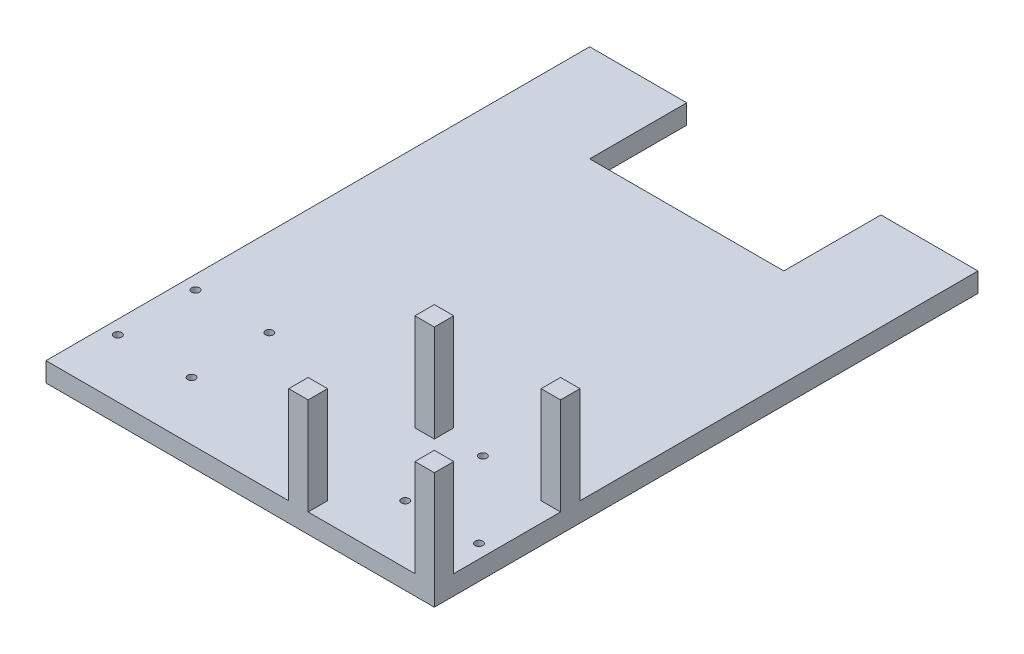
from build123d import *

# Parameters (mm, degrees)
SKETCH3_W           = 200
SKETCH3_H           = 280
BOSS_EXTRUDE1_DEPTH = 10
SKETCH4_W           = 10
SKETCH4_H           = 10
BOSS_EXTRUDE2_DEPTH = 50
SKETCH7_R           = 2
SKETCH7_R_2         = 2.000000006
SKETCH7_R_3         = 1.999999994
CUT_EXTRUDE2_DEPTH  = 10
SKETCH9_W           = 100
SKETCH9_H           = 50
CUT_EXTRUDE4_DEPTH  = 10


with BuildPart() as part:
    # Sketch3 → Boss-Extrude1 (new body)
    with BuildSketch(Plane(origin=(0, 0, 0), x_dir=(1, 0, 0), z_dir=(0, 1, 0))):
        Rectangle(SKETCH3_W, SKETCH3_H)
    extrude(amount=BOSS_EXTRUDE1_DEPTH)

    # Sketch4 → Boss-Extrude2 (add)
    with BuildSketch(Plane(origin=(0, 10, 0), x_dir=(1, 0, 0), z_dir=(0, 1, 0))):
        with Locations((95, -135)):
            Rectangle(SKETCH4_W, SKETCH4_H)
        with Locations((95, -70)):
            Rectangle(SKETCH4_W, SKETCH4_H)
        with Locations((30, -135)):
            Rectangle(SKETCH4_W, SKETCH4_H)
        with Locations((30, -70)):
            Rectangle(SKETCH4_W, SKETCH4_H)
    extrude(amount=BOSS_EXTRUDE2_DEPTH)

    # Sketch7 → Cut-Extrude2 (cut)
    with BuildSketch(Plane.XZ):
        with Locations((-93, 70)):
            Circle(SKETCH7_R)
        with Locations((-93, 110)):
            Circle(SKETCH7_R)
        with Locations((-55, 110)):
            Circle(SKETCH7_R_2)
        with Locations((-55, 70)):
            Circle(SKETCH7_R)
        with Locations((55, 110)):
            Circle(SKETCH7_R_3)
        with Locations((93, 110)):
            Circle(SKETCH7_R)
        with Locations((93, 70)):
            Circle(SKETCH7_R)
        with Locations((55, 70)):
            Circle(SKETCH7_R)
    extrude(amount=-CUT_EXTRUDE2_DEPTH, mode=Mode.SUBTRACT)

    # Sketch9 → Cut-Extrude4 (cut)
    with BuildSketch(Plane(origin=(0, 10, 0), x_dir=(1, 0, 0), z_dir=(0, 1, 0))):
        with Locations((0, 115)):
            Rectangle(SKETCH9_W, SKETCH9_H)
    extrude(amount=-CUT_EXTRUDE4_DEPTH, mode=Mode.SUBTRACT)


solid = part.part
